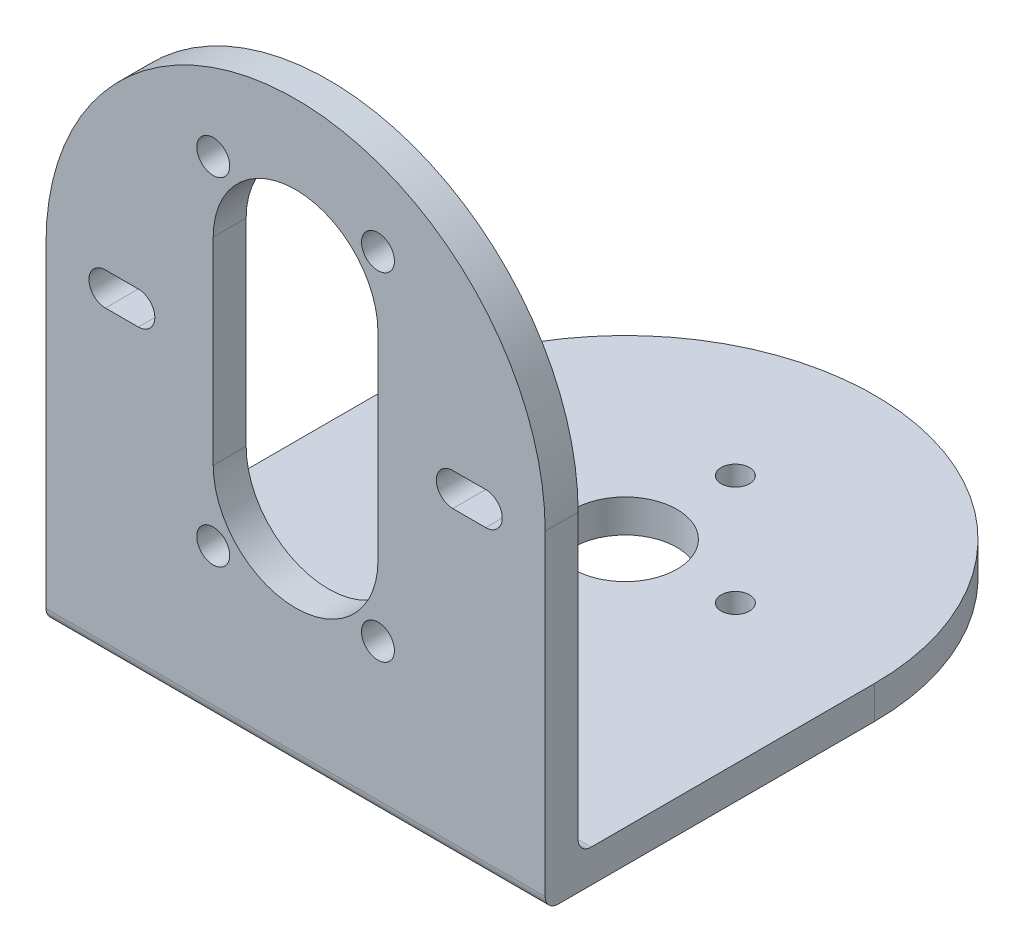
from build123d import *

# Parameters (mm, degrees)
SKETCH1_R           = 4
BOSS_EXTRUDE1_DEPTH = 2.54
SKETCH2_R           = 1.09
CUT_EXTRUDE1_DEPTH  = 5
CIRPATTERN1_COUNT   = 4
SKETCH3_R           = 1.27
BOSS_EXTRUDE2_DEPTH = 2.54
FILLET1_R           = 1


with BuildPart() as part:
    # Sketch1 → Boss-Extrude1 (new body)
    with BuildSketch(Plane(origin=(0, 0, 0), x_dir=(1, 0, 0), z_dir=(0, 1, 0))):
        with BuildLine():
            Line((-19.24, 0), (-19.24, -25.4))
            Line((-19.24, -25.4), (19.24, -25.4))
            Line((19.24, -25.4), (19.24, 0))
            ThreePointArc((19.24, 0), (0, 19.24), (-19.24, 0))
        make_face()
        Circle(SKETCH1_R, mode=Mode.SUBTRACT)
    extrude(amount=BOSS_EXTRUDE1_DEPTH)

    # Sketch2 → Cut-Extrude1 (cut, symmetric)
    with BuildSketch(Plane(origin=(0, 2.54, 0), x_dir=(1, 0, 0), z_dir=(0, 1, 0))):
        with Locations((0, 8.5)):
            Circle(SKETCH2_R)
    cut_extrude1 = extrude(amount=CUT_EXTRUDE1_DEPTH, both=True, mode=Mode.SUBTRACT)

    # CirPattern1: Cut-Extrude1 ×4 about axis
    cirpattern1_axis = Axis((0, 2.54, 0), (0, -1, 0))
    for i in range(1, CIRPATTERN1_COUNT):
        add(cut_extrude1.rotate(cirpattern1_axis, i * 360 / CIRPATTERN1_COUNT), mode=Mode.SUBTRACT)

    # Sketch3 → Boss-Extrude2 (add)
    with BuildSketch(Plane.XY.offset(25.4)):
        with BuildLine():
            Line((19.24, 2.54), (19.24, 25.4))
            ThreePointArc((19.24, 25.4), (0, 44.64), (-19.24, 25.4))
            Line((-19.24, 25.4), (-19.24, 2.54))
            Line((-19.24, 2.54), (19.24, 2.54))
        make_face()
        with Locations((6.35, 37.62)):
            Circle(SKETCH3_R, mode=Mode.SUBTRACT)
        with Locations((6.35, 11.62)):
            Circle(SKETCH3_R, mode=Mode.SUBTRACT)
        with Locations((-6.35, 11.62)):
            Circle(SKETCH3_R, mode=Mode.SUBTRACT)
        with Locations((-6.35, 37.62)):
            Circle(SKETCH3_R, mode=Mode.SUBTRACT)
        with BuildLine():
            Line((6.35, 32.24), (6.35, 17))
            ThreePointArc((6.35, 17), (0, 10.65), (-6.35, 17))
            Line((-6.35, 17), (-6.35, 32.24))
            ThreePointArc((-6.35, 32.24), (0, 38.59), (6.35, 32.24))
        make_face(mode=Mode.SUBTRACT)
        with BuildLine():
            Line((14.66, 25.89), (12.12, 25.89))
            ThreePointArc((12.12, 25.89), (10.85, 24.62), (12.12, 23.35))
            Line((12.12, 23.35), (14.66, 23.35))
            ThreePointArc((14.66, 23.35), (15.93, 24.62), (14.66, 25.89))
        make_face(mode=Mode.SUBTRACT)
        with BuildLine():
            Line((-14.66, 23.35), (-12.12, 23.35))
            ThreePointArc((-12.12, 23.35), (-10.85, 24.62), (-12.12, 25.89))
            Line((-12.12, 25.89), (-14.66, 25.89))
            ThreePointArc((-14.66, 25.89), (-15.93, 24.62), (-14.66, 23.35))
        make_face(mode=Mode.SUBTRACT)
    extrude(amount=-BOSS_EXTRUDE2_DEPTH)

    # Fillet1
    fillet1_edges = [part.edges().sort_by_distance(p)[0] for p in [
        (0, 0, 25.4),
        (0, 2.54, 22.86),
    ]]
    fillet(fillet1_edges, radius=FILLET1_R)


solid = part.part
